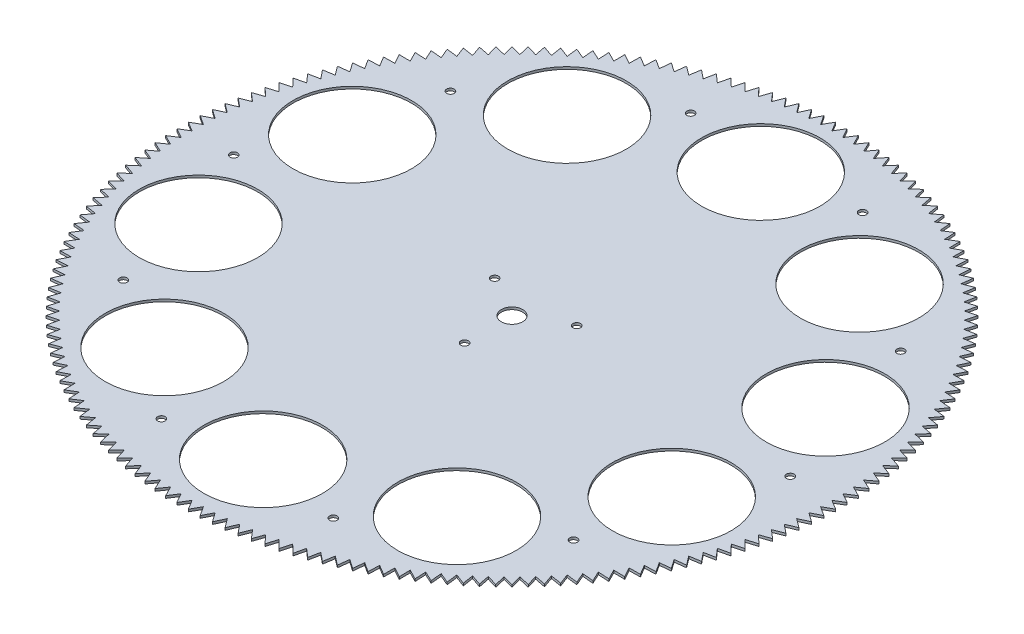
from build123d import *

# Parameters (mm, degrees)
SKETCH1_R          = 135
BASE_FLANGE1_DEPTH = 1
SKETCH2_R          = 25
CUT_EXTRUDE1_DEPTH = 191.921449816
SKETCH7_R          = 4.5
CUT_EXTRUDE2_DEPTH = 1
SKETCH8_R          = 1.6
CUT_EXTRUDE3_DEPTH = 1
SKETCH9_R          = 1.6
CUT_EXTRUDE4_DEPTH = 1
TAB1_START         = -1
TAB1_DEPTH         = 1


# Read off the part's stored shape, not the designer's step: Bend-Lines1
# Sheet-metal steps are written as plain solids
with BuildPart() as part:
    # Sketch1 → Base-Flange1 (new body)
    with BuildSketch(Plane(origin=(0, 0, 0), x_dir=(1, 0, 0), z_dir=(0, 1, 0))):
        with Locations(Location((0, 0, 0), (0, 0, 270))):
            Circle(SKETCH1_R)
    extrude(amount=-BASE_FLANGE1_DEPTH)

    # Sketch2 → Cut-Extrude1 (cut, through all)
    with BuildSketch(Plane(origin=(0, 0, 0), x_dir=(1, 0, 0), z_dir=(0, 1, 0))):
        with Locations(Location((0, 105, 0), (0, 0, 270))):
            Circle(SKETCH2_R)
        with Locations(Location((61.717451491, 84.946784409, 0), (0, 0, 270))):
            Circle(SKETCH2_R)
        with Locations(Location((99.860934211, 32.446784409, 0), (0, 0, 270))):
            Circle(SKETCH2_R)
        with Locations(Location((99.860934211, -32.446784409, 0), (0, 0, 270))):
            Circle(SKETCH2_R)
        with Locations(Location((61.717451491, -84.946784409, 0), (0, 0, 270))):
            Circle(SKETCH2_R)
        with Locations(Location((0, -105, 0), (0, 0, 270))):
            Circle(SKETCH2_R)
        with Locations(Location((-61.717451491, -84.946784409, 0), (0, 0, 270))):
            Circle(SKETCH2_R)
        with Locations(Location((-99.860934211, -32.446784409, 0), (0, 0, 270))):
            Circle(SKETCH2_R)
        with Locations(Location((-99.860934211, 32.446784409, 0), (0, 0, 270))):
            Circle(SKETCH2_R)
        with Locations(Location((-61.717451491, 84.946784409, 0), (0, 0, 270))):
            Circle(SKETCH2_R)
    extrude(amount=-CUT_EXTRUDE1_DEPTH, mode=Mode.SUBTRACT)

    # Sketch7 → Cut-Extrude2 (cut)
    with BuildSketch(Plane(origin=(0, 0, 0), x_dir=(1, 0, 0), z_dir=(0, 1, 0))):
        with Locations(Location((0, 0, 0), (0, 0, 270))):
            Circle(SKETCH7_R)
    extrude(amount=-CUT_EXTRUDE2_DEPTH, mode=Mode.SUBTRACT)

    # Sketch8 → Cut-Extrude3 (cut)
    with BuildSketch(Plane(origin=(0, 0, 0), x_dir=(1, 0, 0), z_dir=(0, 1, 0))):
        with Locations(Location((36.288009993, -111.683010952, 0), (0, 0, 270))):
            Circle(SKETCH8_R)
        with Locations(Location((-36.288009993, -111.683010952, 0), (0, 0, 270))):
            Circle(SKETCH8_R)
        with Locations(Location((-95.003243546, -69.023896734, 0), (0, 0, 270))):
            Circle(SKETCH8_R)
        with Locations(Location((-117.430467105, 0, 0), (0, 0, 270))):
            Circle(SKETCH8_R)
        with Locations(Location((-95.003243546, 69.023896734, 0), (0, 0, 270))):
            Circle(SKETCH8_R)
        with Locations(Location((-36.288009993, 111.683010952, 0), (0, 0, 270))):
            Circle(SKETCH8_R)
        with Locations(Location((36.288009993, 111.683010952, 0), (0, 0, 270))):
            Circle(SKETCH8_R)
        with Locations(Location((95.003243546, 69.023896734, 0), (0, 0, 270))):
            Circle(SKETCH8_R)
        with Locations(Location((117.430467105, 0, 0), (0, 0, 270))):
            Circle(SKETCH8_R)
        with Locations(Location((95.003243546, -69.023896734, 0), (0, 0, 270))):
            Circle(SKETCH8_R)
    extrude(amount=-CUT_EXTRUDE3_DEPTH, mode=Mode.SUBTRACT)

    # Sketch9 → Cut-Extrude4 (cut)
    with BuildSketch(Plane(origin=(0, 0, 0), x_dir=(1, 0, 0), z_dir=(0, 1, 0))):
        with Locations(Location((0, -20, 0), (0, 0, 270))):
            Circle(SKETCH9_R)
        with Locations(Location((-17.320508076, 10, 0), (0, 0, 270))):
            Circle(SKETCH9_R)
        with Locations(Location((17.320508076, 10, 0), (0, 0, 270))):
            Circle(SKETCH9_R)
    extrude(amount=-CUT_EXTRUDE4_DEPTH, mode=Mode.SUBTRACT)

    # Tab1 outline → Tab1 (add)
    with BuildSketch(Plane(origin=(0, 0, 0), x_dir=(1, 0, 0), z_dir=(0, 1, 0)).offset(TAB1_START)):
        with BuildLine():
            Line((23.442503985, 132.949046657), (21.753820545, 137.348217419))
            Line((21.753820545, 137.348217419), (18.78836863, 133.68618928))
            ThreePointArc((18.78836863, 133.68618928), (21.118652781, 133.33792598), (23.442503985, 132.949046657))
        make_face()
        with BuildLine():
            ThreePointArc((14.111342541, 134.260455875), (16.45236136, 133.993730472), (18.78836863, 133.68618928))
            Line((18.78836863, 133.68618928), (16.947185045, 138.023745984))
            Line((16.947185045, 138.023745984), (14.111342541, 134.260455875))
        make_face()
        with BuildLine():
            Line((26.533952367, 136.505351207), (23.442503985, 132.949046657))
            ThreePointArc((23.442503985, 132.949046657), (25.759214376, 132.519669765), (28.06807826, 132.049926099))
            Line((28.06807826, 132.049926099), (26.533952367, 136.505351207))
        make_face()
        with BuildLine():
            ThreePointArc((9.417123955, 134.671146785), (11.766025271, 134.486284242), (14.111342541, 134.260455875))
            Line((14.111342541, 134.260455875), (12.11990201, 138.531113876))
            Line((12.11990201, 138.531113876), (9.417123955, 134.671146785))
        make_face()
        with BuildLine():
            Line((31.281756654, 135.496174253), (28.06807826, 132.049926099))
            ThreePointArc((28.06807826, 132.049926099), (30.368392336, 131.539958746), (32.659455906, 130.989923047))
            Line((32.659455906, 130.989923047), (31.281756654, 135.496174253))
        make_face()
        with BuildLine():
            ThreePointArc((4.711432055, 134.917761648), (7.065354093, 134.814987192), (9.417123955, 134.671146785))
            Line((9.417123955, 134.671146785), (7.277852741, 138.869702945))
            Line((7.277852741, 138.869702945), (4.711432055, 134.917761648))
        make_face()
        with BuildLine():
            Line((35.99144894, 134.321916081), (32.659455906, 130.989923047))
            ThreePointArc((32.659455906, 130.989923047), (34.940571089, 130.399986549), (37.211043035, 129.770328952))
            Line((37.211043035, 129.770328952), (35.99144894, 134.321916081))
        make_face()
        with BuildLine():
            ThreePointArc((0, 135), (2.356074869, 134.979438846), (4.711432055, 134.917761648))
            Line((4.711432055, 134.917761648), (2.42693653, 139.039100671))
            Line((2.42693653, 139.039100671), (0, 135))
        make_face()
        with BuildLine():
            Line((40.657291189, 132.984007345), (37.211043035, 129.770328952))
            ThreePointArc((37.211043035, 129.770328952), (39.470180138, 129.101142055), (41.717294241, 128.3926297))
            Line((41.717294241, 128.3926297), (40.657291189, 132.984007345))
        make_face()
        with BuildLine():
            ThreePointArc((-4.711432055, 134.917761648), (-2.356074869, 134.979438846), (0, 135))
            Line((0, 135), (-2.42693653, 139.039100671))
            Line((-2.42693653, 139.039100671), (-4.711432055, 134.917761648))
        make_face()
        with BuildLine():
            Line((45.273598791, 131.484078081), (41.717294241, 128.3926297))
            ThreePointArc((41.717294241, 128.3926297), (43.951700852, 127.645007706), (46.172719349, 126.858503806))
            Line((46.172719349, 126.858503806), (45.273598791, 131.484078081))
        make_face()
        with BuildLine():
            ThreePointArc((-9.417123955, 134.671146785), (-7.065354093, 134.814987192), (-4.711432055, 134.917761648))
            Line((-4.711432055, 134.917761648), (-7.277852741, 138.869702945))
            Line((-7.277852741, 138.869702945), (-9.417123955, 134.671146785))
        make_face()
        with BuildLine():
            Line((49.834747488, 129.823955722), (46.172719349, 126.858503806))
            ThreePointArc((46.172719349, 126.858503806), (48.379673188, 126.033357577), (50.571890111, 125.169820367))
            Line((50.571890111, 125.169820367), (49.834747488, 129.823955722))
        make_face()
        with BuildLine():
            ThreePointArc((-14.111342541, 134.260455875), (-11.766025271, 134.486284242), (-9.417123955, 134.671146785))
            Line((-9.417123955, 134.671146785), (-12.11990201, 138.531113876))
            Line((-12.11990201, 138.531113876), (-14.111342541, 134.260455875))
        make_face()
        with BuildLine():
            Line((54.335180221, 128.00566287), (50.571890111, 125.169820367))
            ThreePointArc((50.571890111, 125.169820367), (52.748702346, 124.268155216), (54.909446815, 123.328636782))
            Line((54.909446815, 123.328636782), (54.335180221, 128.00566287))
        make_face()
        with BuildLine():
            ThreePointArc((-18.78836863, 133.68618928), (-16.45236136, 133.993730472), (-14.111342541, 134.260455875))
            Line((-14.111342541, 134.260455875), (-16.947185045, 138.023745984))
            Line((-16.947185045, 138.023745984), (-18.78836863, 133.68618928))
        make_face()
        with BuildLine():
            Line((58.769413906, 126.031414836), (54.909446815, 123.328636782))
            ThreePointArc((54.909446815, 123.328636782), (57.053465335, 122.35155125), (59.180104817, 121.33719625))
            Line((59.180104817, 121.33719625), (58.769413906, 126.031414836))
        make_face()
        with BuildLine():
            ThreePointArc((-23.442503985, 132.949046657), (-21.118652781, 133.33792598), (-18.78836863, 133.68618928))
            Line((-18.78836863, 133.68618928), (-21.753820545, 137.348217419))
            Line((-21.753820545, 137.348217419), (-23.442503985, 132.949046657))
        make_face()
        with BuildLine():
            Line((63.132046114, 123.903616937), (59.180104817, 121.33719625))
            ThreePointArc((59.180104817, 121.33719625), (61.288717465, 120.285880765), (63.378660976, 119.197925036))
            Line((63.378660976, 119.197925036), (63.132046114, 123.903616937))
        make_face()
        with BuildLine():
            ThreePointArc((-28.06807826, 132.049926099), (-25.759214376, 132.519669765), (-23.442503985, 132.949046657))
            Line((-23.442503985, 132.949046657), (-26.533952367, 136.505351207))
            Line((-26.533952367, 136.505351207), (-28.06807826, 132.049926099))
        make_face()
        with BuildLine():
            Line((67.417761648, 121.624861566), (63.378660976, 119.197925036))
            ThreePointArc((63.378660976, 119.197925036), (65.449298733, 118.073660464), (67.5, 116.913429511))
            Line((67.5, 116.913429511), (67.417761648, 121.624861566))
        make_face()
        with BuildLine():
            ThreePointArc((-32.659455906, 130.989923047), (-30.368392336, 131.539958746), (-28.06807826, 132.049926099))
            Line((-28.06807826, 132.049926099), (-31.281756654, 135.496174253))
            Line((-31.281756654, 135.496174253), (-32.659455906, 130.989923047))
        make_face()
        with BuildLine():
            Line((71.621339024, 119.197925036), (67.5, 116.913429511))
            ThreePointArc((67.5, 116.913429511), (69.530140113, 115.717585595), (71.539100671, 114.486492981))
            Line((71.539100671, 114.486492981), (71.621339024, 119.197925036))
        make_face()
        with BuildLine():
            ThreePointArc((-37.211043035, 129.770328952), (-34.940571089, 130.399986549), (-32.659455906, 130.989923047))
            Line((-32.659455906, 130.989923047), (-35.99144894, 134.321916081))
            Line((-35.99144894, 134.321916081), (-37.211043035, 129.770328952))
        make_face()
        with BuildLine():
            Line((75.737656831, 116.625764196), (71.539100671, 114.486492981))
            ThreePointArc((71.539100671, 114.486492981), (73.526269727, 113.220526673), (75.491041969, 111.920072295))
            Line((75.491041969, 111.920072295), (75.737656831, 116.625764196))
        make_face()
        with BuildLine():
            ThreePointArc((-41.717294241, 128.3926297), (-39.470180138, 129.101142055), (-37.211043035, 129.770328952))
            Line((-37.211043035, 129.770328952), (-40.657291189, 132.984007345))
            Line((-40.657291189, 132.984007345), (-41.717294241, 128.3926297))
        make_face()
        with BuildLine():
            Line((79.76169997, 113.911512826), (75.491041969, 111.920072295))
            ThreePointArc((75.491041969, 111.920072295), (77.432818907, 110.585525979), (79.351009059, 109.217294241))
            Line((79.351009059, 109.217294241), (79.76169997, 113.911512826))
        make_face()
        with BuildLine():
            ThreePointArc((-46.172719349, 126.858503806), (-43.951700852, 127.645007706), (-41.717294241, 128.3926297))
            Line((-41.717294241, 128.3926297), (-45.273598791, 131.484078081))
            Line((-45.273598791, 131.484078081), (-46.172719349, 126.858503806))
        make_face()
        with BuildLine():
            Line((83.688565764, 111.058477825), (79.351009059, 109.217294241))
            ThreePointArc((79.351009059, 109.217294241), (81.245028125, 107.815793857), (83.114299169, 106.381451737))
            Line((83.114299169, 106.381451737), (83.688565764, 111.058477825))
        make_face()
        with BuildLine():
            ThreePointArc((-50.571890111, 125.169820367), (-48.379673188, 126.033357577), (-46.172719349, 126.858503806))
            Line((-46.172719349, 126.858503806), (-49.834747488, 129.823955722))
            Line((-49.834747488, 129.823955722), (-50.571890111, 125.169820367))
        make_face()
        with BuildLine():
            Line((87.513469931, 108.070135176), (83.114299169, 106.381451737))
            ThreePointArc((83.114299169, 106.381451737), (84.958252792, 104.914704797), (86.776327308, 103.415999821))
            Line((86.776327308, 103.415999821), (87.513469931, 108.070135176))
        make_face()
        with BuildLine():
            ThreePointArc((-54.909446815, 123.328636782), (-52.748702346, 124.268155216), (-50.571890111, 125.169820367))
            Line((-50.571890111, 125.169820367), (-54.335180221, 128.00566287))
            Line((-54.335180221, 128.00566287), (-54.909446815, 123.328636782))
        make_face()
        with BuildLine():
            Line((91.231752416, 104.950125715), (86.776327308, 103.415999821))
            ThreePointArc((86.776327308, 103.415999821), (88.567968914, 101.88579333), (90.332631858, 100.324551439))
            Line((90.332631858, 100.324551439), (91.231752416, 104.950125715))
        make_face()
        with BuildLine():
            ThreePointArc((-59.180104817, 121.33719625), (-57.053465335, 122.35155125), (-54.909446815, 123.328636782))
            Line((-54.909446815, 123.328636782), (-58.769413906, 126.031414836))
            Line((-58.769413906, 126.031414836), (-59.180104817, 121.33719625))
        make_face()
        with BuildLine():
            Line((94.838883064, 101.702250691), (90.332631858, 100.324551439))
            ThreePointArc((90.332631858, 100.324551439), (92.069778608, 98.732749719), (93.778880012, 97.110873046))
            Line((93.778880012, 97.110873046), (94.838883064, 101.702250691))
        make_face()
        with BuildLine():
            ThreePointArc((-63.378660976, 119.197925036), (-61.288717465, 120.285880765), (-59.180104817, 121.33719625))
            Line((-59.180104817, 121.33719625), (-63.132046114, 123.903616937))
            Line((-63.132046114, 123.903616937), (-63.378660976, 119.197925036))
        make_face()
        with BuildLine():
            Line((98.330467141, 98.330467141), (93.778880012, 97.110873046))
            ThreePointArc((93.778880012, 97.110873046), (95.45941546, 95.45941546), (97.110873046, 93.778880012))
            Line((97.110873046, 93.778880012), (98.330467141, 98.330467141))
        make_face()
        with BuildLine():
            ThreePointArc((-67.5, 116.913429511), (-65.449298733, 118.073660464), (-63.378660976, 119.197925036))
            Line((-63.378660976, 119.197925036), (-67.417761648, 121.624861566))
            Line((-67.417761648, 121.624861566), (-67.5, 116.913429511))
        make_face()
        with BuildLine():
            Line((101.702250691, 94.838883064), (97.110873046, 93.778880012))
            ThreePointArc((97.110873046, 93.778880012), (98.732749719, 92.069778608), (100.324551439, 90.332631858))
            Line((100.324551439, 90.332631858), (101.702250691, 94.838883064))
        make_face()
        with BuildLine():
            ThreePointArc((-71.539100671, 114.486492981), (-69.530140113, 115.717585595), (-67.5, 116.913429511))
            Line((-67.5, 116.913429511), (-71.621339024, 119.197925036))
            Line((-71.621339024, 119.197925036), (-71.539100671, 114.486492981))
        make_face()
        with BuildLine():
            Line((104.950125715, 91.231752416), (100.324551439, 90.332631858))
            ThreePointArc((100.324551439, 90.332631858), (101.88579333, 88.567968914), (103.415999821, 86.776327308))
            Line((103.415999821, 86.776327308), (104.950125715, 91.231752416))
        make_face()
        with BuildLine():
            ThreePointArc((-75.491041969, 111.920072295), (-73.526269727, 113.220526673), (-71.539100671, 114.486492981))
            Line((-71.539100671, 114.486492981), (-75.737656831, 116.625764196))
            Line((-75.737656831, 116.625764196), (-75.491041969, 111.920072295))
        make_face()
        with BuildLine():
            Line((108.070135176, 87.513469931), (103.415999821, 86.776327308))
            ThreePointArc((103.415999821, 86.776327308), (104.914704797, 84.958252792), (106.381451737, 83.114299169))
            Line((106.381451737, 83.114299169), (108.070135176, 87.513469931))
        make_face()
        with BuildLine():
            ThreePointArc((-79.351009059, 109.217294241), (-77.432818907, 110.585525979), (-75.491041969, 111.920072295))
            Line((-75.491041969, 111.920072295), (-79.76169997, 113.911512826))
            Line((-79.76169997, 113.911512826), (-79.351009059, 109.217294241))
        make_face()
        with BuildLine():
            Line((111.058477825, 83.688565764), (106.381451737, 83.114299169))
            ThreePointArc((106.381451737, 83.114299169), (107.815793857, 81.245028125), (109.217294241, 79.351009059))
            Line((109.217294241, 79.351009059), (111.058477825, 83.688565764))
        make_face()
        with BuildLine():
            ThreePointArc((-83.114299169, 106.381451737), (-81.245028125, 107.815793857), (-79.351009059, 109.217294241))
            Line((-79.351009059, 109.217294241), (-83.688565764, 111.058477825))
            Line((-83.688565764, 111.058477825), (-83.114299169, 106.381451737))
        make_face()
        with BuildLine():
            Line((113.911512826, 79.76169997), (109.217294241, 79.351009059))
            ThreePointArc((109.217294241, 79.351009059), (110.585525979, 77.432818907), (111.920072295, 75.491041969))
            Line((111.920072295, 75.491041969), (113.911512826, 79.76169997))
        make_face()
        with BuildLine():
            ThreePointArc((-86.776327308, 103.415999821), (-84.958252792, 104.914704797), (-83.114299169, 106.381451737))
            Line((-83.114299169, 106.381451737), (-87.513469931, 108.070135176))
            Line((-87.513469931, 108.070135176), (-86.776327308, 103.415999821))
        make_face()
        with BuildLine():
            Line((116.625764196, 75.737656831), (111.920072295, 75.491041969))
            ThreePointArc((111.920072295, 75.491041969), (113.220526673, 73.526269727), (114.486492981, 71.539100671))
            Line((114.486492981, 71.539100671), (116.625764196, 75.737656831))
        make_face()
        with BuildLine():
            ThreePointArc((-90.332631858, 100.324551439), (-88.567968914, 101.88579333), (-86.776327308, 103.415999821))
            Line((-86.776327308, 103.415999821), (-91.231752416, 104.950125715))
            Line((-91.231752416, 104.950125715), (-90.332631858, 100.324551439))
        make_face()
        with BuildLine():
            Line((119.197925036, 71.621339024), (114.486492981, 71.539100671))
            ThreePointArc((114.486492981, 71.539100671), (115.717585595, 69.530140113), (116.913429511, 67.5))
            Line((116.913429511, 67.5), (119.197925036, 71.621339024))
        make_face()
        with BuildLine():
            ThreePointArc((-93.778880012, 97.110873046), (-92.069778608, 98.732749719), (-90.332631858, 100.324551439))
            Line((-90.332631858, 100.324551439), (-94.838883064, 101.702250691))
            Line((-94.838883064, 101.702250691), (-93.778880012, 97.110873046))
        make_face()
        with BuildLine():
            Line((121.624861566, 67.417761648), (116.913429511, 67.5))
            ThreePointArc((116.913429511, 67.5), (118.073660464, 65.449298733), (119.197925036, 63.378660976))
            Line((119.197925036, 63.378660976), (121.624861566, 67.417761648))
        make_face()
        with BuildLine():
            ThreePointArc((-97.110873046, 93.778880012), (-95.45941546, 95.45941546), (-93.778880012, 97.110873046))
            Line((-93.778880012, 97.110873046), (-98.330467141, 98.330467141))
            Line((-98.330467141, 98.330467141), (-97.110873046, 93.778880012))
        make_face()
        with BuildLine():
            Line((123.903616937, 63.132046114), (119.197925036, 63.378660976))
            ThreePointArc((119.197925036, 63.378660976), (120.285880765, 61.288717465), (121.33719625, 59.180104817))
            Line((121.33719625, 59.180104817), (123.903616937, 63.132046114))
        make_face()
        with BuildLine():
            ThreePointArc((-100.324551439, 90.332631858), (-98.732749719, 92.069778608), (-97.110873046, 93.778880012))
            Line((-97.110873046, 93.778880012), (-101.702250691, 94.838883064))
            Line((-101.702250691, 94.838883064), (-100.324551439, 90.332631858))
        make_face()
        with BuildLine():
            Line((126.031414836, 58.769413906), (121.33719625, 59.180104817))
            ThreePointArc((121.33719625, 59.180104817), (122.35155125, 57.053465335), (123.328636782, 54.909446815))
            Line((123.328636782, 54.909446815), (126.031414836, 58.769413906))
        make_face()
        with BuildLine():
            ThreePointArc((-103.415999821, 86.776327308), (-101.88579333, 88.567968914), (-100.324551439, 90.332631858))
            Line((-100.324551439, 90.332631858), (-104.950125715, 91.231752416))
            Line((-104.950125715, 91.231752416), (-103.415999821, 86.776327308))
        make_face()
        with BuildLine():
            Line((128.00566287, 54.335180221), (123.328636782, 54.909446815))
            ThreePointArc((123.328636782, 54.909446815), (124.268155216, 52.748702346), (125.169820367, 50.571890111))
            Line((125.169820367, 50.571890111), (128.00566287, 54.335180221))
        make_face()
        with BuildLine():
            ThreePointArc((-106.381451737, 83.114299169), (-104.914704797, 84.958252792), (-103.415999821, 86.776327308))
            Line((-103.415999821, 86.776327308), (-108.070135176, 87.513469931))
            Line((-108.070135176, 87.513469931), (-106.381451737, 83.114299169))
        make_face()
        with BuildLine():
            Line((129.823955722, 49.834747488), (125.169820367, 50.571890111))
            ThreePointArc((125.169820367, 50.571890111), (126.033357577, 48.379673188), (126.858503806, 46.172719349))
            Line((126.858503806, 46.172719349), (129.823955722, 49.834747488))
        make_face()
        with BuildLine():
            ThreePointArc((-109.217294241, 79.351009059), (-107.815793857, 81.245028125), (-106.381451737, 83.114299169))
            Line((-106.381451737, 83.114299169), (-111.058477825, 83.688565764))
            Line((-111.058477825, 83.688565764), (-109.217294241, 79.351009059))
        make_face()
        with BuildLine():
            Line((131.484078081, 45.273598791), (126.858503806, 46.172719349))
            ThreePointArc((126.858503806, 46.172719349), (127.645007706, 43.951700852), (128.3926297, 41.717294241))
            Line((128.3926297, 41.717294241), (131.484078081, 45.273598791))
        make_face()
        with BuildLine():
            ThreePointArc((-111.920072295, 75.491041969), (-110.585525979, 77.432818907), (-109.217294241, 79.351009059))
            Line((-109.217294241, 79.351009059), (-113.911512826, 79.76169997))
            Line((-113.911512826, 79.76169997), (-111.920072295, 75.491041969))
        make_face()
        with BuildLine():
            Line((132.984007345, 40.657291189), (128.3926297, 41.717294241))
            ThreePointArc((128.3926297, 41.717294241), (129.101142055, 39.470180138), (129.770328952, 37.211043035))
            Line((129.770328952, 37.211043035), (132.984007345, 40.657291189))
        make_face()
        with BuildLine():
            ThreePointArc((-114.486492981, 71.539100671), (-113.220526673, 73.526269727), (-111.920072295, 75.491041969))
            Line((-111.920072295, 75.491041969), (-116.625764196, 75.737656831))
            Line((-116.625764196, 75.737656831), (-114.486492981, 71.539100671))
        make_face()
        with BuildLine():
            Line((134.321916081, 35.99144894), (129.770328952, 37.211043035))
            ThreePointArc((129.770328952, 37.211043035), (130.399986549, 34.940571089), (130.989923047, 32.659455906))
            Line((130.989923047, 32.659455906), (134.321916081, 35.99144894))
        make_face()
        with BuildLine():
            ThreePointArc((-116.913429511, 67.5), (-115.717585595, 69.530140113), (-114.486492981, 71.539100671))
            Line((-114.486492981, 71.539100671), (-119.197925036, 71.621339024))
            Line((-119.197925036, 71.621339024), (-116.913429511, 67.5))
        make_face()
        with BuildLine():
            Line((135.496174253, 31.281756654), (130.989923047, 32.659455906))
            ThreePointArc((130.989923047, 32.659455906), (131.539958746, 30.368392336), (132.049926099, 28.06807826))
            Line((132.049926099, 28.06807826), (135.496174253, 31.281756654))
        make_face()
        with BuildLine():
            ThreePointArc((-119.197925036, 63.378660976), (-118.073660464, 65.449298733), (-116.913429511, 67.5))
            Line((-116.913429511, 67.5), (-121.624861566, 67.417761648))
            Line((-121.624861566, 67.417761648), (-119.197925036, 63.378660976))
        make_face()
        with BuildLine():
            Line((136.505351207, 26.533952367), (132.049926099, 28.06807826))
            ThreePointArc((132.049926099, 28.06807826), (132.519669765, 25.759214376), (132.949046657, 23.442503985))
            Line((132.949046657, 23.442503985), (136.505351207, 26.533952367))
        make_face()
        with BuildLine():
            ThreePointArc((-121.33719625, 59.180104817), (-120.285880765, 61.288717465), (-119.197925036, 63.378660976))
            Line((-119.197925036, 63.378660976), (-123.903616937, 63.132046114))
            Line((-123.903616937, 63.132046114), (-121.33719625, 59.180104817))
        make_face()
        with BuildLine():
            Line((137.348217419, 21.753820545), (132.949046657, 23.442503985))
            ThreePointArc((132.949046657, 23.442503985), (133.33792598, 21.118652781), (133.68618928, 18.78836863))
            Line((133.68618928, 18.78836863), (137.348217419, 21.753820545))
        make_face()
        with BuildLine():
            ThreePointArc((-123.328636782, 54.909446815), (-122.35155125, 57.053465335), (-121.33719625, 59.180104817))
            Line((-121.33719625, 59.180104817), (-126.031414836, 58.769413906))
            Line((-126.031414836, 58.769413906), (-123.328636782, 54.909446815))
        make_face()
        with BuildLine():
            Line((138.023745984, 16.947185045), (133.68618928, 18.78836863))
            ThreePointArc((133.68618928, 18.78836863), (133.993730472, 16.45236136), (134.260455875, 14.111342541))
            Line((134.260455875, 14.111342541), (138.023745984, 16.947185045))
        make_face()
        with BuildLine():
            ThreePointArc((-125.169820367, 50.571890111), (-124.268155216, 52.748702346), (-123.328636782, 54.909446815))
            Line((-123.328636782, 54.909446815), (-128.00566287, 54.335180221))
            Line((-128.00566287, 54.335180221), (-125.169820367, 50.571890111))
        make_face()
        with BuildLine():
            Line((138.531113876, 12.11990201), (134.260455875, 14.111342541))
            ThreePointArc((134.260455875, 14.111342541), (134.486284242, 11.766025271), (134.671146785, 9.417123955))
            Line((134.671146785, 9.417123955), (138.531113876, 12.11990201))
        make_face()
        with BuildLine():
            ThreePointArc((-126.858503806, 46.172719349), (-126.033357577, 48.379673188), (-125.169820367, 50.571890111))
            Line((-125.169820367, 50.571890111), (-129.823955722, 49.834747488))
            Line((-129.823955722, 49.834747488), (-126.858503806, 46.172719349))
        make_face()
        with BuildLine():
            Line((138.869702945, 7.277852741), (134.671146785, 9.417123955))
            ThreePointArc((134.671146785, 9.417123955), (134.814987192, 7.065354093), (134.917761648, 4.711432055))
            Line((134.917761648, 4.711432055), (138.869702945, 7.277852741))
        make_face()
        with BuildLine():
            ThreePointArc((-128.3926297, 41.717294241), (-127.645007706, 43.951700852), (-126.858503806, 46.172719349))
            Line((-126.858503806, 46.172719349), (-131.484078081, 45.273598791))
            Line((-131.484078081, 45.273598791), (-128.3926297, 41.717294241))
        make_face()
        with BuildLine():
            Line((139.039100671, 2.42693653), (134.917761648, 4.711432055))
            ThreePointArc((134.917761648, 4.711432055), (134.979438846, 2.356074869), (135, 0))
            Line((135, 0), (139.039100671, 2.42693653))
        make_face()
        with BuildLine():
            ThreePointArc((-129.770328952, 37.211043035), (-129.101142055, 39.470180138), (-128.3926297, 41.717294241))
            Line((-128.3926297, 41.717294241), (-132.984007345, 40.657291189))
            Line((-132.984007345, 40.657291189), (-129.770328952, 37.211043035))
        make_face()
        with BuildLine():
            Line((139.039100671, -2.42693653), (135, 0))
            ThreePointArc((135, 0), (134.979438846, -2.356074869), (134.917761648, -4.711432055))
            Line((134.917761648, -4.711432055), (139.039100671, -2.42693653))
        make_face()
        with BuildLine():
            ThreePointArc((-130.989923047, 32.659455906), (-130.399986549, 34.940571089), (-129.770328952, 37.211043035))
            Line((-129.770328952, 37.211043035), (-134.321916081, 35.99144894))
            Line((-134.321916081, 35.99144894), (-130.989923047, 32.659455906))
        make_face()
        with BuildLine():
            Line((138.869702945, -7.277852741), (134.917761648, -4.711432055))
            ThreePointArc((134.917761648, -4.711432055), (134.814987192, -7.065354093), (134.671146785, -9.417123955))
            Line((134.671146785, -9.417123955), (138.869702945, -7.277852741))
        make_face()
        with BuildLine():
            ThreePointArc((-132.049926099, 28.06807826), (-131.539958746, 30.368392336), (-130.989923047, 32.659455906))
            Line((-130.989923047, 32.659455906), (-135.496174253, 31.281756654))
            Line((-135.496174253, 31.281756654), (-132.049926099, 28.06807826))
        make_face()
        with BuildLine():
            Line((138.531113876, -12.11990201), (134.671146785, -9.417123955))
            ThreePointArc((134.671146785, -9.417123955), (134.486284242, -11.766025271), (134.260455875, -14.111342541))
            Line((134.260455875, -14.111342541), (138.531113876, -12.11990201))
        make_face()
        with BuildLine():
            ThreePointArc((-132.949046657, 23.442503985), (-132.519669765, 25.759214376), (-132.049926099, 28.06807826))
            Line((-132.049926099, 28.06807826), (-136.505351207, 26.533952367))
            Line((-136.505351207, 26.533952367), (-132.949046657, 23.442503985))
        make_face()
        with BuildLine():
            Line((138.023745984, -16.947185045), (134.260455875, -14.111342541))
            ThreePointArc((134.260455875, -14.111342541), (133.993730472, -16.45236136), (133.68618928, -18.78836863))
            Line((133.68618928, -18.78836863), (138.023745984, -16.947185045))
        make_face()
        with BuildLine():
            ThreePointArc((-133.68618928, 18.78836863), (-133.33792598, 21.118652781), (-132.949046657, 23.442503985))
            Line((-132.949046657, 23.442503985), (-137.348217419, 21.753820545))
            Line((-137.348217419, 21.753820545), (-133.68618928, 18.78836863))
        make_face()
        with BuildLine():
            Line((137.348217419, -21.753820545), (133.68618928, -18.78836863))
            ThreePointArc((133.68618928, -18.78836863), (133.33792598, -21.118652781), (132.949046657, -23.442503985))
            Line((132.949046657, -23.442503985), (137.348217419, -21.753820545))
        make_face()
        with BuildLine():
            ThreePointArc((-134.260455875, 14.111342541), (-133.993730472, 16.45236136), (-133.68618928, 18.78836863))
            Line((-133.68618928, 18.78836863), (-138.023745984, 16.947185045))
            Line((-138.023745984, 16.947185045), (-134.260455875, 14.111342541))
        make_face()
        with BuildLine():
            Line((136.505351207, -26.533952367), (132.949046657, -23.442503985))
            ThreePointArc((132.949046657, -23.442503985), (132.519669765, -25.759214376), (132.049926099, -28.06807826))
            Line((132.049926099, -28.06807826), (136.505351207, -26.533952367))
        make_face()
        with BuildLine():
            ThreePointArc((-134.671146785, 9.417123955), (-134.486284242, 11.766025271), (-134.260455875, 14.111342541))
            Line((-134.260455875, 14.111342541), (-138.531113876, 12.11990201))
            Line((-138.531113876, 12.11990201), (-134.671146785, 9.417123955))
        make_face()
        with BuildLine():
            Line((135.496174253, -31.281756654), (132.049926099, -28.06807826))
            ThreePointArc((132.049926099, -28.06807826), (131.539958746, -30.368392336), (130.989923047, -32.659455906))
            Line((130.989923047, -32.659455906), (135.496174253, -31.281756654))
        make_face()
        with BuildLine():
            ThreePointArc((-134.917761648, 4.711432055), (-134.814987192, 7.065354093), (-134.671146785, 9.417123955))
            Line((-134.671146785, 9.417123955), (-138.869702945, 7.277852741))
            Line((-138.869702945, 7.277852741), (-134.917761648, 4.711432055))
        make_face()
        with BuildLine():
            Line((134.321916081, -35.99144894), (130.989923047, -32.659455906))
            ThreePointArc((130.989923047, -32.659455906), (130.399986549, -34.940571089), (129.770328952, -37.211043035))
            Line((129.770328952, -37.211043035), (134.321916081, -35.99144894))
        make_face()
        with BuildLine():
            ThreePointArc((-135, 0), (-134.979438846, 2.356074869), (-134.917761648, 4.711432055))
            Line((-134.917761648, 4.711432055), (-139.039100671, 2.42693653))
            Line((-139.039100671, 2.42693653), (-135, 0))
        make_face()
        with BuildLine():
            Line((132.984007345, -40.657291189), (129.770328952, -37.211043035))
            ThreePointArc((129.770328952, -37.211043035), (129.101142055, -39.470180138), (128.3926297, -41.717294241))
            Line((128.3926297, -41.717294241), (132.984007345, -40.657291189))
        make_face()
        with BuildLine():
            ThreePointArc((-134.917761648, -4.711432055), (-134.979438846, -2.356074869), (-135, 0))
            Line((-135, 0), (-139.039100671, -2.42693653))
            Line((-139.039100671, -2.42693653), (-134.917761648, -4.711432055))
        make_face()
        with BuildLine():
            Line((131.484078081, -45.273598791), (128.3926297, -41.717294241))
            ThreePointArc((128.3926297, -41.717294241), (127.645007706, -43.951700852), (126.858503806, -46.172719349))
            Line((126.858503806, -46.172719349), (131.484078081, -45.273598791))
        make_face()
        with BuildLine():
            ThreePointArc((-134.671146785, -9.417123955), (-134.814987192, -7.065354093), (-134.917761648, -4.711432055))
            Line((-134.917761648, -4.711432055), (-138.869702945, -7.277852741))
            Line((-138.869702945, -7.277852741), (-134.671146785, -9.417123955))
        make_face()
        with BuildLine():
            Line((129.823955722, -49.834747488), (126.858503806, -46.172719349))
            ThreePointArc((126.858503806, -46.172719349), (126.033357577, -48.379673188), (125.169820367, -50.571890111))
            Line((125.169820367, -50.571890111), (129.823955722, -49.834747488))
        make_face()
        with BuildLine():
            ThreePointArc((-134.260455875, -14.111342541), (-134.486284242, -11.766025271), (-134.671146785, -9.417123955))
            Line((-134.671146785, -9.417123955), (-138.531113876, -12.11990201))
            Line((-138.531113876, -12.11990201), (-134.260455875, -14.111342541))
        make_face()
        with BuildLine():
            Line((128.00566287, -54.335180221), (125.169820367, -50.571890111))
            ThreePointArc((125.169820367, -50.571890111), (124.268155216, -52.748702346), (123.328636782, -54.909446815))
            Line((123.328636782, -54.909446815), (128.00566287, -54.335180221))
        make_face()
        with BuildLine():
            ThreePointArc((-133.68618928, -18.78836863), (-133.993730472, -16.45236136), (-134.260455875, -14.111342541))
            Line((-134.260455875, -14.111342541), (-138.023745984, -16.947185045))
            Line((-138.023745984, -16.947185045), (-133.68618928, -18.78836863))
        make_face()
        with BuildLine():
            Line((126.031414836, -58.769413906), (123.328636782, -54.909446815))
            ThreePointArc((123.328636782, -54.909446815), (122.35155125, -57.053465335), (121.33719625, -59.180104817))
            Line((121.33719625, -59.180104817), (126.031414836, -58.769413906))
        make_face()
        with BuildLine():
            ThreePointArc((-132.949046657, -23.442503985), (-133.33792598, -21.118652781), (-133.68618928, -18.78836863))
            Line((-133.68618928, -18.78836863), (-137.348217419, -21.753820545))
            Line((-137.348217419, -21.753820545), (-132.949046657, -23.442503985))
        make_face()
        with BuildLine():
            Line((123.903616937, -63.132046114), (121.33719625, -59.180104817))
            ThreePointArc((121.33719625, -59.180104817), (120.285880765, -61.288717465), (119.197925036, -63.378660976))
            Line((119.197925036, -63.378660976), (123.903616937, -63.132046114))
        make_face()
        with BuildLine():
            ThreePointArc((-132.049926099, -28.06807826), (-132.519669765, -25.759214376), (-132.949046657, -23.442503985))
            Line((-132.949046657, -23.442503985), (-136.505351207, -26.533952367))
            Line((-136.505351207, -26.533952367), (-132.049926099, -28.06807826))
        make_face()
        with BuildLine():
            Line((121.624861566, -67.417761648), (119.197925036, -63.378660976))
            ThreePointArc((119.197925036, -63.378660976), (118.073660464, -65.449298733), (116.913429511, -67.5))
            Line((116.913429511, -67.5), (121.624861566, -67.417761648))
        make_face()
        with BuildLine():
            ThreePointArc((-130.989923047, -32.659455906), (-131.539958746, -30.368392336), (-132.049926099, -28.06807826))
            Line((-132.049926099, -28.06807826), (-135.496174253, -31.281756654))
            Line((-135.496174253, -31.281756654), (-130.989923047, -32.659455906))
        make_face()
        with BuildLine():
            Line((119.197925036, -71.621339024), (116.913429511, -67.5))
            ThreePointArc((116.913429511, -67.5), (115.717585595, -69.530140113), (114.486492981, -71.539100671))
            Line((114.486492981, -71.539100671), (119.197925036, -71.621339024))
        make_face()
        with BuildLine():
            ThreePointArc((-129.770328952, -37.211043035), (-130.399986549, -34.940571089), (-130.989923047, -32.659455906))
            Line((-130.989923047, -32.659455906), (-134.321916081, -35.99144894))
            Line((-134.321916081, -35.99144894), (-129.770328952, -37.211043035))
        make_face()
        with BuildLine():
            Line((116.625764196, -75.737656831), (114.486492981, -71.539100671))
            ThreePointArc((114.486492981, -71.539100671), (113.220526673, -73.526269727), (111.920072295, -75.491041969))
            Line((111.920072295, -75.491041969), (116.625764196, -75.737656831))
        make_face()
        with BuildLine():
            ThreePointArc((-128.3926297, -41.717294241), (-129.101142055, -39.470180138), (-129.770328952, -37.211043035))
            Line((-129.770328952, -37.211043035), (-132.984007345, -40.657291189))
            Line((-132.984007345, -40.657291189), (-128.3926297, -41.717294241))
        make_face()
        with BuildLine():
            Line((113.911512826, -79.76169997), (111.920072295, -75.491041969))
            ThreePointArc((111.920072295, -75.491041969), (110.585525979, -77.432818907), (109.217294241, -79.351009059))
            Line((109.217294241, -79.351009059), (113.911512826, -79.76169997))
        make_face()
        with BuildLine():
            ThreePointArc((-126.858503806, -46.172719349), (-127.645007706, -43.951700852), (-128.3926297, -41.717294241))
            Line((-128.3926297, -41.717294241), (-131.484078081, -45.273598791))
            Line((-131.484078081, -45.273598791), (-126.858503806, -46.172719349))
        make_face()
        with BuildLine():
            Line((111.058477825, -83.688565764), (109.217294241, -79.351009059))
            ThreePointArc((109.217294241, -79.351009059), (107.815793857, -81.245028125), (106.381451737, -83.114299169))
            Line((106.381451737, -83.114299169), (111.058477825, -83.688565764))
        make_face()
        with BuildLine():
            ThreePointArc((-125.169820367, -50.571890111), (-126.033357577, -48.379673188), (-126.858503806, -46.172719349))
            Line((-126.858503806, -46.172719349), (-129.823955722, -49.834747488))
            Line((-129.823955722, -49.834747488), (-125.169820367, -50.571890111))
        make_face()
        with BuildLine():
            Line((108.070135176, -87.513469931), (106.381451737, -83.114299169))
            ThreePointArc((106.381451737, -83.114299169), (104.914704797, -84.958252792), (103.415999821, -86.776327308))
            Line((103.415999821, -86.776327308), (108.070135176, -87.513469931))
        make_face()
        with BuildLine():
            ThreePointArc((-123.328636782, -54.909446815), (-124.268155216, -52.748702346), (-125.169820367, -50.571890111))
            Line((-125.169820367, -50.571890111), (-128.00566287, -54.335180221))
            Line((-128.00566287, -54.335180221), (-123.328636782, -54.909446815))
        make_face()
        with BuildLine():
            Line((104.950125715, -91.231752416), (103.415999821, -86.776327308))
            ThreePointArc((103.415999821, -86.776327308), (101.88579333, -88.567968914), (100.324551439, -90.332631858))
            Line((100.324551439, -90.332631858), (104.950125715, -91.231752416))
        make_face()
        with BuildLine():
            ThreePointArc((-121.33719625, -59.180104817), (-122.35155125, -57.053465335), (-123.328636782, -54.909446815))
            Line((-123.328636782, -54.909446815), (-126.031414836, -58.769413906))
            Line((-126.031414836, -58.769413906), (-121.33719625, -59.180104817))
        make_face()
        with BuildLine():
            Line((101.702250691, -94.838883064), (100.324551439, -90.332631858))
            ThreePointArc((100.324551439, -90.332631858), (98.732749719, -92.069778608), (97.110873046, -93.778880012))
            Line((97.110873046, -93.778880012), (101.702250691, -94.838883064))
        make_face()
        with BuildLine():
            ThreePointArc((-119.197925036, -63.378660976), (-120.285880765, -61.288717465), (-121.33719625, -59.180104817))
            Line((-121.33719625, -59.180104817), (-123.903616937, -63.132046114))
            Line((-123.903616937, -63.132046114), (-119.197925036, -63.378660976))
        make_face()
        with BuildLine():
            Line((98.330467141, -98.330467141), (97.110873046, -93.778880012))
            ThreePointArc((97.110873046, -93.778880012), (95.45941546, -95.45941546), (93.778880012, -97.110873046))
            Line((93.778880012, -97.110873046), (98.330467141, -98.330467141))
        make_face()
        with BuildLine():
            ThreePointArc((-116.913429511, -67.5), (-118.073660464, -65.449298733), (-119.197925036, -63.378660976))
            Line((-119.197925036, -63.378660976), (-121.624861566, -67.417761648))
            Line((-121.624861566, -67.417761648), (-116.913429511, -67.5))
        make_face()
        with BuildLine():
            Line((94.838883064, -101.702250691), (93.778880012, -97.110873046))
            ThreePointArc((93.778880012, -97.110873046), (92.069778608, -98.732749719), (90.332631858, -100.324551439))
            Line((90.332631858, -100.324551439), (94.838883064, -101.702250691))
        make_face()
        with BuildLine():
            ThreePointArc((-114.486492981, -71.539100671), (-115.717585595, -69.530140113), (-116.913429511, -67.5))
            Line((-116.913429511, -67.5), (-119.197925036, -71.621339024))
            Line((-119.197925036, -71.621339024), (-114.486492981, -71.539100671))
        make_face()
        with BuildLine():
            Line((91.231752416, -104.950125715), (90.332631858, -100.324551439))
            ThreePointArc((90.332631858, -100.324551439), (88.567968914, -101.88579333), (86.776327308, -103.415999821))
            Line((86.776327308, -103.415999821), (91.231752416, -104.950125715))
        make_face()
        with BuildLine():
            ThreePointArc((-111.920072295, -75.491041969), (-113.220526673, -73.526269727), (-114.486492981, -71.539100671))
            Line((-114.486492981, -71.539100671), (-116.625764196, -75.737656831))
            Line((-116.625764196, -75.737656831), (-111.920072295, -75.491041969))
        make_face()
        with BuildLine():
            Line((87.513469931, -108.070135176), (86.776327308, -103.415999821))
            ThreePointArc((86.776327308, -103.415999821), (84.958252792, -104.914704797), (83.114299169, -106.381451737))
            Line((83.114299169, -106.381451737), (87.513469931, -108.070135176))
        make_face()
        with BuildLine():
            ThreePointArc((-109.217294241, -79.351009059), (-110.585525979, -77.432818907), (-111.920072295, -75.491041969))
            Line((-111.920072295, -75.491041969), (-113.911512826, -79.76169997))
            Line((-113.911512826, -79.76169997), (-109.217294241, -79.351009059))
        make_face()
        with BuildLine():
            Line((83.688565764, -111.058477825), (83.114299169, -106.381451737))
            ThreePointArc((83.114299169, -106.381451737), (81.245028125, -107.815793857), (79.351009059, -109.217294241))
            Line((79.351009059, -109.217294241), (83.688565764, -111.058477825))
        make_face()
        with BuildLine():
            ThreePointArc((-106.381451737, -83.114299169), (-107.815793857, -81.245028125), (-109.217294241, -79.351009059))
            Line((-109.217294241, -79.351009059), (-111.058477825, -83.688565764))
            Line((-111.058477825, -83.688565764), (-106.381451737, -83.114299169))
        make_face()
        with BuildLine():
            Line((79.76169997, -113.911512826), (79.351009059, -109.217294241))
            ThreePointArc((79.351009059, -109.217294241), (77.432818907, -110.585525979), (75.491041969, -111.920072295))
            Line((75.491041969, -111.920072295), (79.76169997, -113.911512826))
        make_face()
        with BuildLine():
            ThreePointArc((-103.415999821, -86.776327308), (-104.914704797, -84.958252792), (-106.381451737, -83.114299169))
            Line((-106.381451737, -83.114299169), (-108.070135176, -87.513469931))
            Line((-108.070135176, -87.513469931), (-103.415999821, -86.776327308))
        make_face()
        with BuildLine():
            Line((75.737656831, -116.625764196), (75.491041969, -111.920072295))
            ThreePointArc((75.491041969, -111.920072295), (73.526269727, -113.220526673), (71.539100671, -114.486492981))
            Line((71.539100671, -114.486492981), (75.737656831, -116.625764196))
        make_face()
        with BuildLine():
            ThreePointArc((-100.324551439, -90.332631858), (-101.88579333, -88.567968914), (-103.415999821, -86.776327308))
            Line((-103.415999821, -86.776327308), (-104.950125715, -91.231752416))
            Line((-104.950125715, -91.231752416), (-100.324551439, -90.332631858))
        make_face()
        with BuildLine():
            Line((71.621339024, -119.197925036), (71.539100671, -114.486492981))
            ThreePointArc((71.539100671, -114.486492981), (69.530140113, -115.717585595), (67.5, -116.913429511))
            Line((67.5, -116.913429511), (71.621339024, -119.197925036))
        make_face()
        with BuildLine():
            ThreePointArc((-97.110873046, -93.778880012), (-98.732749719, -92.069778608), (-100.324551439, -90.332631858))
            Line((-100.324551439, -90.332631858), (-101.702250691, -94.838883064))
            Line((-101.702250691, -94.838883064), (-97.110873046, -93.778880012))
        make_face()
        with BuildLine():
            Line((67.417761648, -121.624861566), (67.5, -116.913429511))
            ThreePointArc((67.5, -116.913429511), (65.449298733, -118.073660464), (63.378660976, -119.197925036))
            Line((63.378660976, -119.197925036), (67.417761648, -121.624861566))
        make_face()
        with BuildLine():
            ThreePointArc((-93.778880012, -97.110873046), (-95.45941546, -95.45941546), (-97.110873046, -93.778880012))
            Line((-97.110873046, -93.778880012), (-98.330467141, -98.330467141))
            Line((-98.330467141, -98.330467141), (-93.778880012, -97.110873046))
        make_face()
        with BuildLine():
            Line((63.132046114, -123.903616937), (63.378660976, -119.197925036))
            ThreePointArc((63.378660976, -119.197925036), (61.288717465, -120.285880765), (59.180104817, -121.33719625))
            Line((59.180104817, -121.33719625), (63.132046114, -123.903616937))
        make_face()
        with BuildLine():
            ThreePointArc((-90.332631858, -100.324551439), (-92.069778608, -98.732749719), (-93.778880012, -97.110873046))
            Line((-93.778880012, -97.110873046), (-94.838883064, -101.702250691))
            Line((-94.838883064, -101.702250691), (-90.332631858, -100.324551439))
        make_face()
        with BuildLine():
            Line((58.769413906, -126.031414836), (59.180104817, -121.33719625))
            ThreePointArc((59.180104817, -121.33719625), (57.053465335, -122.35155125), (54.909446815, -123.328636782))
            Line((54.909446815, -123.328636782), (58.769413906, -126.031414836))
        make_face()
        with BuildLine():
            ThreePointArc((-86.776327308, -103.415999821), (-88.567968914, -101.88579333), (-90.332631858, -100.324551439))
            Line((-90.332631858, -100.324551439), (-91.231752416, -104.950125715))
            Line((-91.231752416, -104.950125715), (-86.776327308, -103.415999821))
        make_face()
        with BuildLine():
            Line((54.335180221, -128.00566287), (54.909446815, -123.328636782))
            ThreePointArc((54.909446815, -123.328636782), (52.748702346, -124.268155216), (50.571890111, -125.169820367))
            Line((50.571890111, -125.169820367), (54.335180221, -128.00566287))
        make_face()
        with BuildLine():
            ThreePointArc((-83.114299169, -106.381451737), (-84.958252792, -104.914704797), (-86.776327308, -103.415999821))
            Line((-86.776327308, -103.415999821), (-87.513469931, -108.070135176))
            Line((-87.513469931, -108.070135176), (-83.114299169, -106.381451737))
        make_face()
        with BuildLine():
            Line((49.834747488, -129.823955722), (50.571890111, -125.169820367))
            ThreePointArc((50.571890111, -125.169820367), (48.379673188, -126.033357577), (46.172719349, -126.858503806))
            Line((46.172719349, -126.858503806), (49.834747488, -129.823955722))
        make_face()
        with BuildLine():
            ThreePointArc((-79.351009059, -109.217294241), (-81.245028125, -107.815793857), (-83.114299169, -106.381451737))
            Line((-83.114299169, -106.381451737), (-83.688565764, -111.058477825))
            Line((-83.688565764, -111.058477825), (-79.351009059, -109.217294241))
        make_face()
        with BuildLine():
            Line((45.273598791, -131.484078081), (46.172719349, -126.858503806))
            ThreePointArc((46.172719349, -126.858503806), (43.951700852, -127.645007706), (41.717294241, -128.3926297))
            Line((41.717294241, -128.3926297), (45.273598791, -131.484078081))
        make_face()
        with BuildLine():
            ThreePointArc((-75.491041969, -111.920072295), (-77.432818907, -110.585525979), (-79.351009059, -109.217294241))
            Line((-79.351009059, -109.217294241), (-79.76169997, -113.911512826))
            Line((-79.76169997, -113.911512826), (-75.491041969, -111.920072295))
        make_face()
        with BuildLine():
            Line((40.657291189, -132.984007345), (41.717294241, -128.3926297))
            ThreePointArc((41.717294241, -128.3926297), (39.470180138, -129.101142055), (37.211043035, -129.770328952))
            Line((37.211043035, -129.770328952), (40.657291189, -132.984007345))
        make_face()
        with BuildLine():
            ThreePointArc((-71.539100671, -114.486492981), (-73.526269727, -113.220526673), (-75.491041969, -111.920072295))
            Line((-75.491041969, -111.920072295), (-75.737656831, -116.625764196))
            Line((-75.737656831, -116.625764196), (-71.539100671, -114.486492981))
        make_face()
        with BuildLine():
            Line((35.99144894, -134.321916081), (37.211043035, -129.770328952))
            ThreePointArc((37.211043035, -129.770328952), (34.940571089, -130.399986549), (32.659455906, -130.989923047))
            Line((32.659455906, -130.989923047), (35.99144894, -134.321916081))
        make_face()
        with BuildLine():
            ThreePointArc((-67.5, -116.913429511), (-69.530140113, -115.717585595), (-71.539100671, -114.486492981))
            Line((-71.539100671, -114.486492981), (-71.621339024, -119.197925036))
            Line((-71.621339024, -119.197925036), (-67.5, -116.913429511))
        make_face()
        with BuildLine():
            Line((31.281756654, -135.496174253), (32.659455906, -130.989923047))
            ThreePointArc((32.659455906, -130.989923047), (30.368392336, -131.539958746), (28.06807826, -132.049926099))
            Line((28.06807826, -132.049926099), (31.281756654, -135.496174253))
        make_face()
        with BuildLine():
            ThreePointArc((-63.378660976, -119.197925036), (-65.449298733, -118.073660464), (-67.5, -116.913429511))
            Line((-67.5, -116.913429511), (-67.417761648, -121.624861566))
            Line((-67.417761648, -121.624861566), (-63.378660976, -119.197925036))
        make_face()
        with BuildLine():
            Line((26.533952367, -136.505351207), (28.06807826, -132.049926099))
            ThreePointArc((28.06807826, -132.049926099), (25.759214376, -132.519669765), (23.442503985, -132.949046657))
            Line((23.442503985, -132.949046657), (26.533952367, -136.505351207))
        make_face()
        with BuildLine():
            ThreePointArc((-59.180104817, -121.33719625), (-61.288717465, -120.285880765), (-63.378660976, -119.197925036))
            Line((-63.378660976, -119.197925036), (-63.132046114, -123.903616937))
            Line((-63.132046114, -123.903616937), (-59.180104817, -121.33719625))
        make_face()
        with BuildLine():
            Line((21.753820545, -137.348217419), (23.442503985, -132.949046657))
            ThreePointArc((23.442503985, -132.949046657), (21.118652781, -133.33792598), (18.78836863, -133.68618928))
            Line((18.78836863, -133.68618928), (21.753820545, -137.348217419))
        make_face()
        with BuildLine():
            ThreePointArc((-54.909446815, -123.328636782), (-57.053465335, -122.35155125), (-59.180104817, -121.33719625))
            Line((-59.180104817, -121.33719625), (-58.769413906, -126.031414836))
            Line((-58.769413906, -126.031414836), (-54.909446815, -123.328636782))
        make_face()
        with BuildLine():
            Line((16.947185045, -138.023745984), (18.78836863, -133.68618928))
            ThreePointArc((18.78836863, -133.68618928), (16.45236136, -133.993730472), (14.111342541, -134.260455875))
            Line((14.111342541, -134.260455875), (16.947185045, -138.023745984))
        make_face()
        with BuildLine():
            ThreePointArc((-50.571890111, -125.169820367), (-52.748702346, -124.268155216), (-54.909446815, -123.328636782))
            Line((-54.909446815, -123.328636782), (-54.335180221, -128.00566287))
            Line((-54.335180221, -128.00566287), (-50.571890111, -125.169820367))
        make_face()
        with BuildLine():
            Line((12.11990201, -138.531113876), (14.111342541, -134.260455875))
            ThreePointArc((14.111342541, -134.260455875), (11.766025271, -134.486284242), (9.417123955, -134.671146785))
            Line((9.417123955, -134.671146785), (12.11990201, -138.531113876))
        make_face()
        with BuildLine():
            ThreePointArc((-46.172719349, -126.858503806), (-48.379673188, -126.033357577), (-50.571890111, -125.169820367))
            Line((-50.571890111, -125.169820367), (-49.834747488, -129.823955722))
            Line((-49.834747488, -129.823955722), (-46.172719349, -126.858503806))
        make_face()
        with BuildLine():
            Line((7.277852741, -138.869702945), (9.417123955, -134.671146785))
            ThreePointArc((9.417123955, -134.671146785), (7.065354093, -134.814987192), (4.711432055, -134.917761648))
            Line((4.711432055, -134.917761648), (7.277852741, -138.869702945))
        make_face()
        with BuildLine():
            ThreePointArc((-41.717294241, -128.3926297), (-43.951700852, -127.645007706), (-46.172719349, -126.858503806))
            Line((-46.172719349, -126.858503806), (-45.273598791, -131.484078081))
            Line((-45.273598791, -131.484078081), (-41.717294241, -128.3926297))
        make_face()
        with BuildLine():
            Line((2.42693653, -139.039100671), (4.711432055, -134.917761648))
            ThreePointArc((4.711432055, -134.917761648), (2.356074869, -134.979438846), (0, -135))
            Line((0, -135), (2.42693653, -139.039100671))
        make_face()
        with BuildLine():
            ThreePointArc((-37.211043035, -129.770328952), (-39.470180138, -129.101142055), (-41.717294241, -128.3926297))
            Line((-41.717294241, -128.3926297), (-40.657291189, -132.984007345))
            Line((-40.657291189, -132.984007345), (-37.211043035, -129.770328952))
        make_face()
        with BuildLine():
            Line((-2.42693653, -139.039100671), (0, -135))
            ThreePointArc((0, -135), (-2.356074869, -134.979438846), (-4.711432055, -134.917761648))
            Line((-4.711432055, -134.917761648), (-2.42693653, -139.039100671))
        make_face()
        with BuildLine():
            ThreePointArc((-32.659455906, -130.989923047), (-34.940571089, -130.399986549), (-37.211043035, -129.770328952))
            Line((-37.211043035, -129.770328952), (-35.99144894, -134.321916081))
            Line((-35.99144894, -134.321916081), (-32.659455906, -130.989923047))
        make_face()
        with BuildLine():
            Line((-7.277852741, -138.869702945), (-4.711432055, -134.917761648))
            ThreePointArc((-4.711432055, -134.917761648), (-7.065354093, -134.814987192), (-9.417123955, -134.671146785))
            Line((-9.417123955, -134.671146785), (-7.277852741, -138.869702945))
        make_face()
        with BuildLine():
            ThreePointArc((-28.06807826, -132.049926099), (-30.368392336, -131.539958746), (-32.659455906, -130.989923047))
            Line((-32.659455906, -130.989923047), (-31.281756654, -135.496174253))
            Line((-31.281756654, -135.496174253), (-28.06807826, -132.049926099))
        make_face()
        with BuildLine():
            Line((-12.11990201, -138.531113876), (-9.417123955, -134.671146785))
            ThreePointArc((-9.417123955, -134.671146785), (-11.766025271, -134.486284242), (-14.111342541, -134.260455875))
            Line((-14.111342541, -134.260455875), (-12.11990201, -138.531113876))
        make_face()
        with BuildLine():
            ThreePointArc((-23.442503985, -132.949046657), (-25.759214376, -132.519669765), (-28.06807826, -132.049926099))
            Line((-28.06807826, -132.049926099), (-26.533952367, -136.505351207))
            Line((-26.533952367, -136.505351207), (-23.442503985, -132.949046657))
        make_face()
        with BuildLine():
            Line((-16.947185045, -138.023745984), (-14.111342541, -134.260455875))
            ThreePointArc((-14.111342541, -134.260455875), (-16.45236136, -133.993730472), (-18.78836863, -133.68618928))
            Line((-18.78836863, -133.68618928), (-16.947185045, -138.023745984))
        make_face()
        with BuildLine():
            ThreePointArc((-18.78836863, -133.68618928), (-21.118652781, -133.33792598), (-23.442503985, -132.949046657))
            Line((-23.442503985, -132.949046657), (-21.753820545, -137.348217419))
            Line((-21.753820545, -137.348217419), (-18.78836863, -133.68618928))
        make_face()
    extrude(amount=TAB1_DEPTH)


solid = part.part
